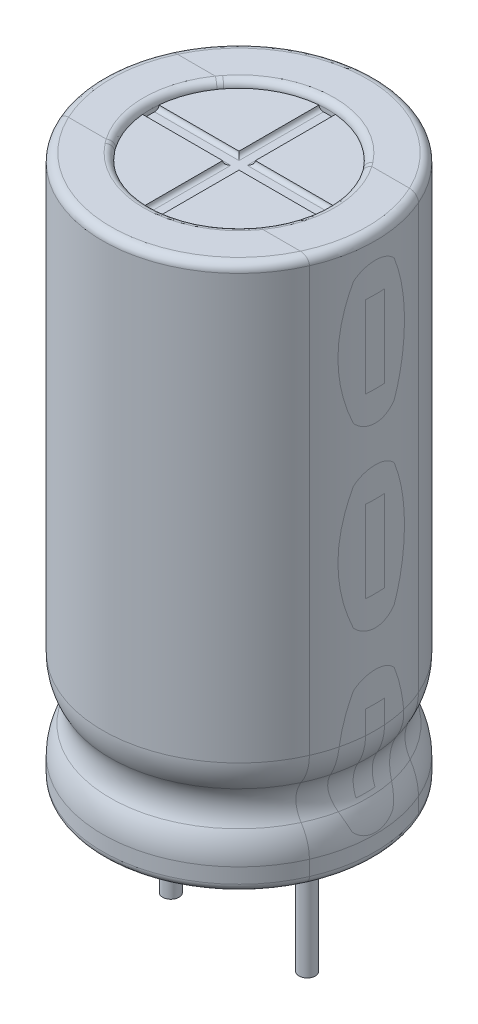
from build123d import *

# Parameters (mm, degrees)
SKETCH_2_R          = 3.25
CUT_EXTRUDE_1_DEPTH = 0.25
CUT_EXTRUDE_2_DEPTH = 0.15
FILLET_1_R          = 0.3
FILLET_2_R          = 2
CUT_EXTRUDE_START   = -0.25
SKETCH_4_R          = 3.25
CUT_EXTRUDE_3_DEPTH = 0.25
SKETCH_5_R          = 0.3
EXTRUDE_1_DEPTH     = 5
FILLET_3_R          = 0.15
FILLET_4_R          = 0.25
FILLET_5_R          = 0.2


with BuildPart() as part:
    # Эскиз1 → Повернуть2 (revolve)
    with BuildSketch(Plane.XY, mode=Mode.PRIVATE) as revolve_2_sk:
        with BuildLine():
            Line((0, 0), (-5, 0))
            Line((-5, 0), (-5, 1.539531364))
            ThreePointArc((-5, 1.539531364), (-4.55, 2.5), (-5, 3.460468636))
            Line((-5, 3.460468636), (-5, 20))
            Line((-5, 20), (0, 20))
            Line((0, 20), (0, 0))
        make_face()
    revolve(revolve_2_sk.sketch.rotate(Axis((0, 47.03836845, 0), (0, -1, 0)), 270), axis=Axis((0, 47.03836845, 0), (0, -1, 0)))

    # Эскиз2 → Вырез-Вытянуть1 (cut)
    with BuildSketch(Plane(origin=(0, 20, 0), x_dir=(1, 0, 0), z_dir=(0, 1, 0))):
        with Locations(Location((0, 0, 0), (0, 0, 270))):
            Circle(SKETCH_2_R)
    extrude(amount=-CUT_EXTRUDE_1_DEPTH, mode=Mode.SUBTRACT)

    # Эскиз3 → Вырез-Вытянуть2 (cut)
    with BuildSketch(Plane(origin=(0, 19.75, 0), x_dir=(1, 0, 0), z_dir=(0, 1, 0))):
        with BuildLine():
            Line((-0.3, 3.236124225), (-0.3, 0.3))
            Line((-0.3, 0.3), (-3.236124225, 0.3))
            ThreePointArc((-3.236124225, 0.3), (-3.25, 0), (-3.236124225, -0.3))
            Line((-3.236124225, -0.3), (-0.3, -0.3))
            Line((-0.3, -0.3), (-0.3, -3.236124225))
            ThreePointArc((-0.3, -3.236124225), (0, -3.25), (0.3, -3.236124225))
            Line((0.3, -3.236124225), (0.3, -0.3))
            Line((0.3, -0.3), (3.236124225, -0.3))
            ThreePointArc((3.236124225, -0.3), (3.25, 0), (3.236124225, 0.3))
            Line((3.236124225, 0.3), (0.3, 0.3))
            Line((0.3, 0.3), (0.3, 3.236124225))
            ThreePointArc((0.3, 3.236124225), (0, 3.25), (-0.3, 3.236124225))
        make_face()
    extrude(amount=-CUT_EXTRUDE_2_DEPTH, mode=Mode.SUBTRACT)

    # Скругление1
    fillet_1_edges = [part.edges().sort_by_distance(p)[0] for p in [
        (0, 0, -5),
        (0, 20, -5),
    ]]
    fillet(fillet_1_edges, radius=FILLET_1_R)

    # Скругление2
    fillet_2_edges = [part.edges().sort_by_distance(p)[0] for p in [
        (0, 1.539531364, -5),
        (0, 3.460468636, -5),
    ]]
    fillet(fillet_2_edges, radius=FILLET_2_R)

    # Эскиз4 → Вырез-Вытянуть3 (cut)
    with BuildSketch(Plane.XZ.offset(CUT_EXTRUDE_START)):
        with Locations(Location((0, 0, 0), (0, 0, 90))):
            Circle(SKETCH_4_R)
    extrude(amount=CUT_EXTRUDE_3_DEPTH, mode=Mode.SUBTRACT)

    # Эскиз5 → Бобышка-Вытянуть1 (add)
    with BuildSketch(Plane.XZ.offset(-0.25)):
        with Locations(Location((-2.5, 0, 0), (0, 0, 270))):
            Circle(SKETCH_5_R)
        with Locations(Location((2.5, 0, 0), (0, 0, 90))):
            Circle(SKETCH_5_R)
    extrude(amount=EXTRUDE_1_DEPTH)

    # Скругление3
    fillet_3_edges = [part.edges().sort_by_distance(p)[0] for p in [
        (0.3, 19.6, -1.768062113),
        (-1.768062113, 19.6, 0.3),
        (1.768062113, 19.6, 0.3),
        (0.3, 19.6, 1.768062113),
        (-0.3, 19.6, 1.768062113),
        (1.768062113, 19.6, -0.3),
        (-0.3, 19.6, -1.768062113),
        (-1.768062113, 19.6, -0.3),
    ]]
    fillet(fillet_3_edges, radius=FILLET_3_R - 0.0001)  # a hair under: the kernel refuses the full size

    # Скругление4
    fillet_4_edges = [part.edges().sort_by_distance(p)[0] for p in [
        (0, 20, -3.25),
    ]]
    fillet(fillet_4_edges, radius=FILLET_4_R - 0.0001)  # a hair under: the kernel refuses the full size

    # Скругление5
    fillet_5_edges = [part.edges().sort_by_distance(p)[0] for p in [
        (0, 0, -3.25),
        (0, 0, -3.25),
        (0, 0, -3.25),
        (0, 0, -3.25),
    ]]
    fillet(fillet_5_edges, radius=FILLET_5_R)


solid = part.part
